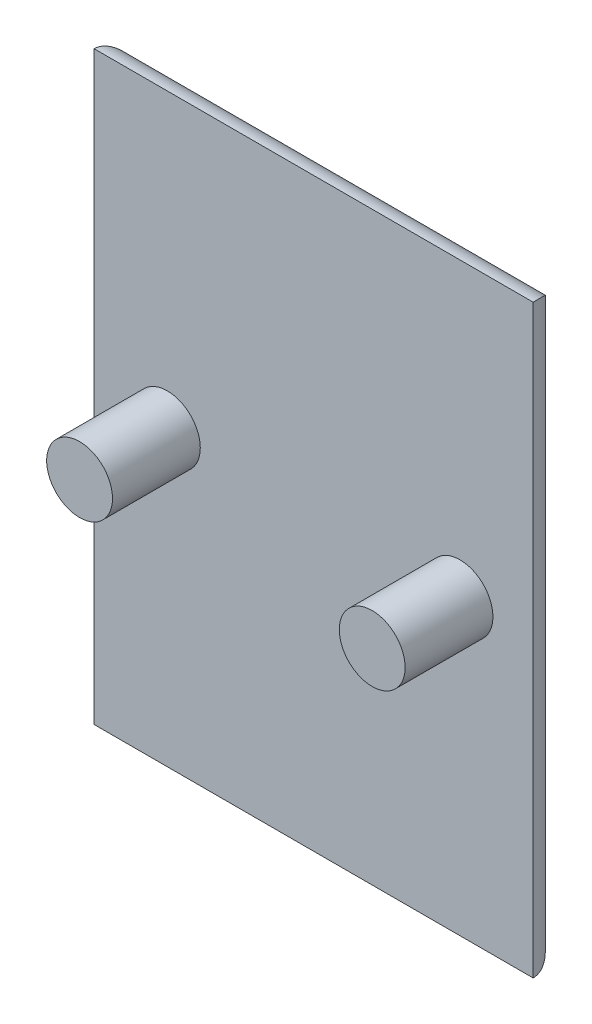
from build123d import *

# Parameters (mm, degrees)
SKETCH1_W           = 30
SKETCH1_H           = 40
SKETCH1_R           = 2.25
BOSS_EXTRUDE1_DEPTH = 2
SKETCH1_4_R         = 2.25
BOSS_EXTRUDE2_DEPTH = 8
FILLET1_R           = 2


with BuildPart() as part:
    # Sketch1 → Boss-Extrude1 (new body)
    with BuildSketch(Plane.XY):
        Rectangle(SKETCH1_W, SKETCH1_H)
        with Locations((-10, 0)):
            Circle(SKETCH1_R, mode=Mode.SUBTRACT)
        with Locations(Location((10, 0, 0), (0, 0, 180))):
            Circle(SKETCH1_R, mode=Mode.SUBTRACT)
    extrude(amount=BOSS_EXTRUDE1_DEPTH)

    # Sketch1<4> → Boss-Extrude2 (add)
    with BuildSketch(Plane.XY):
        with Locations((-10, 0)):
            Circle(SKETCH1_4_R)
        with Locations(Location((10, 0, 0), (0, 0, 180))):
            Circle(SKETCH1_4_R)
    extrude(amount=BOSS_EXTRUDE2_DEPTH)

    # Fillet1
    fillet1_edges = [part.edges().sort_by_distance(p)[0] for p in [
        (0, 20, 0),
        (-15, 0, 0),
        (0, -20, 0),
        (15, 0, 0),
    ]]
    fillet(fillet1_edges, radius=FILLET1_R - 0.0001)  # a hair under: the kernel refuses the full size


solid = part.part
